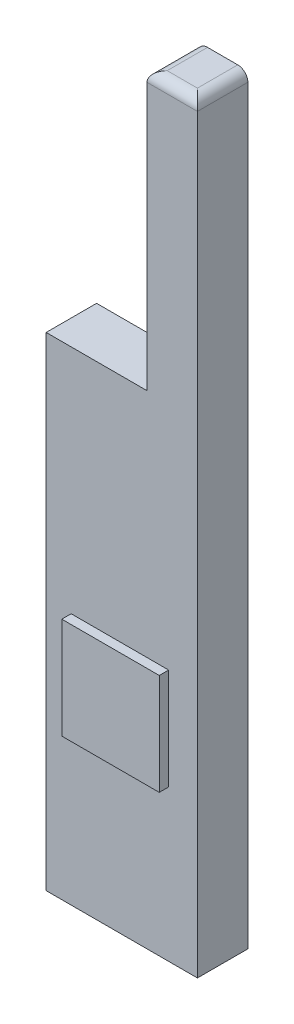
from build123d import *

# Parameters (mm, degrees)
BOSS_EXTRUDE1_DEPTH = 5
SKETCH2_W           = 9.666916436
SKETCH2_H           = 10.042928676
BOSS_EXTRUDE2_DEPTH = 5.93
FILLET1_R           = 1
SKETCH3_R           = 1.029396526
CUT_EXTRUDE1_DEPTH  = 0.5


with BuildPart() as part:
    # Sketch1 → Boss-Extrude1 (new body)
    with BuildSketch(Plane.XY):
        Polygon((10, 12), (10, -15.48), (0, -15.48), (0, -63.42), (15, -63.42), (15, 12), align=None)
    extrude(amount=BOSS_EXTRUDE1_DEPTH)

    # Sketch2 → Boss-Extrude2 (add)
    with BuildSketch(Plane(origin=(0, 0, 0), x_dir=(-1, 0, 0), z_dir=(0, 0, -1))):
        with Locations((-7.313213371, -43.42)):
            Rectangle(SKETCH2_W, SKETCH2_H)
    extrude(amount=-BOSS_EXTRUDE2_DEPTH)

    # Fillet1
    fillet1_edges = [part.edges().sort_by_distance(p)[0] for p in [
        (10, 12, 2.5),
        (15, 12, 2.5),
        (12.5, 12, 5),
    ]]
    fillet(fillet1_edges, radius=FILLET1_R)

    # Sketch3 → Cut-Extrude1 (cut)
    with BuildSketch(Plane.XZ.offset(63.42)):
        with Locations((12.5, 2.5)):
            Circle(SKETCH3_R)
    extrude(amount=-CUT_EXTRUDE1_DEPTH, mode=Mode.SUBTRACT)


solid = part.part
